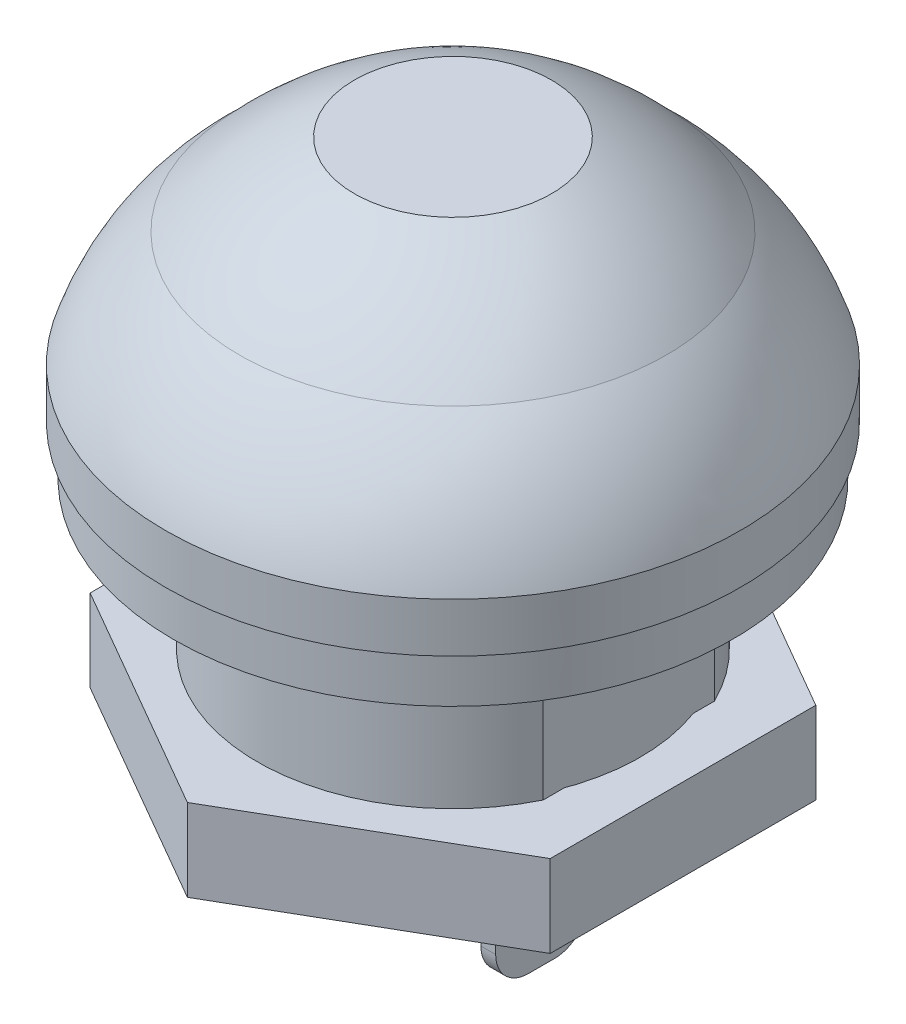
from build123d import *

# Parameters (mm, degrees)
BOSS_EXTRUDE1_DEPTH = 7
BOSS_EXTRUDE2_DEPTH = 1.5
SKETCH3_R           = 8.75
BOSS_EXTRUDE3_DEPTH = 1.5
SKETCH5_R           = 5.010854022
BOSS_EXTRUDE4_DEPTH = 1
SKETCH6_W           = 0.45
SKETCH6_H           = 2.8
BOSS_EXTRUDE5_DEPTH = 3.5
CUT_EXTRUDE1_DEPTH  = 19.436783994
FILLET1_R           = 1
SKETCH8_R           = 8.5
SKETCH8_R_2         = 7
BOSS_EXTRUDE6_DEPTH = 1.5
SKETCH9_R           = 5.7
BOSS_EXTRUDE7_DEPTH = 2.5


with BuildPart() as part:
    # Sketch1 → Boss-Extrude1 (new body)
    with BuildSketch(Plane(origin=(0, 0, 0), x_dir=(1, 0, 0), z_dir=(0, 1, 0))):
        with BuildLine():
            Line((-5.35, 2.603843313), (-5.35, -2.603843313))
            ThreePointArc((-5.35, -2.603843313), (0, -5.95), (5.35, -2.603843313))
            Line((5.35, -2.603843313), (5.35, 2.603843313))
            ThreePointArc((5.35, 2.603843313), (0, 5.95), (-5.35, 2.603843313))
        make_face()
    extrude(amount=-BOSS_EXTRUDE1_DEPTH)

    # Sketch2 → Boss-Extrude2 (add)
    with BuildSketch(Plane(origin=(0, 0, 0), x_dir=(1, 0, 0), z_dir=(0, 1, 0))):
        with BuildLine():
            Line((-2.754995463, -6.025), (2.754995463, -6.025))
            ThreePointArc((2.754995463, -6.025), (0, 6.625), (-2.754995463, -6.025))
        make_face()
    extrude(amount=BOSS_EXTRUDE2_DEPTH)

    # Sketch3 → Boss-Extrude3 (add)
    with BuildSketch(Plane(origin=(0, 1.5, 0), x_dir=(1, 0, 0), z_dir=(0, 1, 0))):
        Circle(SKETCH3_R)
    extrude(amount=BOSS_EXTRUDE3_DEPTH)

    # Sketch4 → Revolve2 (revolve)
    with BuildSketch(Plane.XY):
        with BuildLine():
            Line((0, 1.5), (0, 6.5))
            Line((0, 6.5), (0, 9))
            Line((0, 9), (-3, 9))
            ThreePointArc((-3, 9), (-4.886002476, 7.940403467), (-6.5, 6.5))
            ThreePointArc((-6.5, 6.5), (-7.856528253, 4.898839592), (-8.75, 3))
            Line((-8.75, 3), (-8.75, 1.5))
            Line((-8.75, 1.5), (0, 1.5))
        make_face()
    revolve(axis=Axis((0, 1.5, 0), (0, -1, 0)))

    # Sketch5 → Boss-Extrude4 (add)
    with BuildSketch(Plane.XZ.offset(7)):
        Circle(SKETCH5_R)
    extrude(amount=BOSS_EXTRUDE4_DEPTH)

    # Sketch6 → Boss-Extrude5 (add)
    with BuildSketch(Plane.XZ.offset(8)):
        with Locations((-2.475, 0)):
            Rectangle(SKETCH6_W, SKETCH6_H)
        with Locations((2.475, 0)):
            Rectangle(SKETCH6_W, SKETCH6_H)
    extrude(amount=BOSS_EXTRUDE5_DEPTH)

    # Sketch7 → Cut-Extrude1 (cut, through all)
    with BuildSketch(Plane(origin=(2.7, 0, 0), x_dir=(0, 0, -1), z_dir=(1, 0, 0))):
        with BuildLine():
            Line((0.6, -9.35), (0.6, -10.15))
            ThreePointArc((0.6, -10.15), (0, -10.75), (-0.6, -10.15))
            Line((-0.6, -10.15), (-0.6, -9.35))
            ThreePointArc((-0.6, -9.35), (0, -8.75), (0.6, -9.35))
        make_face()
    extrude(amount=-CUT_EXTRUDE1_DEPTH, mode=Mode.SUBTRACT)

    # Fillet1
    fillet1_edges = [part.edges().sort_by_distance(p)[0] for p in [
        (-2.475, -11.5, -1.4),
        (-2.475, -11.5, 1.4),
        (2.475, -11.5, -1.4),
        (2.475, -11.5, 1.4),
    ]]
    fillet(fillet1_edges, radius=FILLET1_R)

    # Sketch8 → Boss-Extrude6 (add)
    with BuildSketch(Plane.XZ.offset(-1.5)):
        Circle(SKETCH8_R)
        Circle(SKETCH8_R_2, mode=Mode.SUBTRACT)
    extrude(amount=BOSS_EXTRUDE6_DEPTH)


with BuildPart() as body_2:
    # Sketch9 → Boss-Extrude7 (new body)
    with BuildSketch(Plane.XZ.offset(7)):
        Polygon((0, -8.082903769), (7, -4.041451884), (7, 4.041451884), (0, 8.082903769), (-7, 4.041451884), (-7, -4.041451884), align=None)
        Circle(SKETCH9_R, mode=Mode.SUBTRACT)
    extrude(amount=-BOSS_EXTRUDE7_DEPTH)


solid = Compound([part.part, body_2.part])
